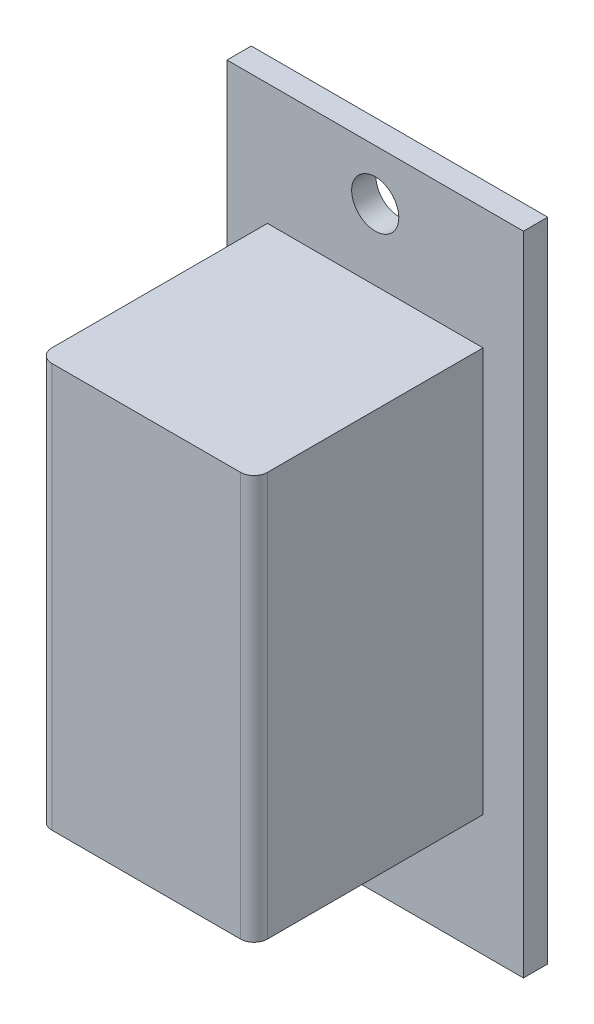
from build123d import *

# Parameters (mm, degrees)
SKETCH_1_W      = 22
SKETCH_1_H      = 48
SKETCH_1_R      = 1.75
EXTRUDE_1_DEPTH = 1.8
SKETCH_2_W      = 16
SKETCH_2_H      = 30
EXTRUDE_2_DEPTH = 17
FILLET_1_R      = 1


with BuildPart() as part:
    # 草图1 → 拉伸1 (new body)
    with BuildSketch(Plane.XY):
        Rectangle(SKETCH_1_W, SKETCH_1_H)
        with Locations((0, 20.25)):
            Circle(SKETCH_1_R, mode=Mode.SUBTRACT)
        with Locations((0, -20.25)):
            Circle(SKETCH_1_R, mode=Mode.SUBTRACT)
    extrude(amount=EXTRUDE_1_DEPTH)

    # 草图2 → 拉伸2 (add)
    with BuildSketch(Plane.XY.offset(1.8)):
        Rectangle(SKETCH_2_W, SKETCH_2_H)
    extrude(amount=EXTRUDE_2_DEPTH)

    # 圆角1
    fillet_1_edges = [part.edges().sort_by_distance(p)[0] for p in [
        (-8, 0, 18.8),
        (8, 0, 18.8),
    ]]
    fillet(fillet_1_edges, radius=FILLET_1_R)


solid = part.part
